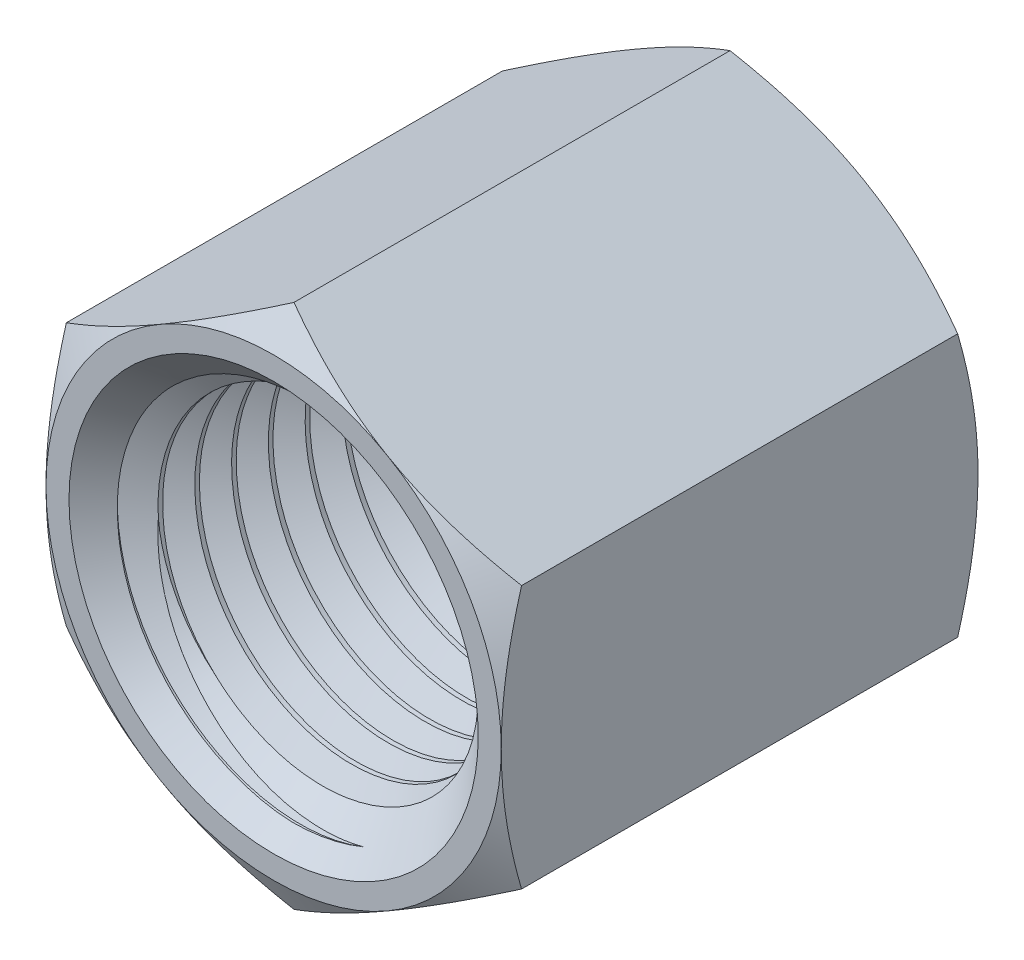
from build123d import *

# Parameters (mm, degrees)
BOSS_EXTRUDE1_DEPTH          = 9.144
BOSS_EXTRUDE1_DEPTH_BACK     = 9.144
SKETCH2_R                    = 5.588
SKETCH4_OUTSIDE_W            = 34.73
SKETCH4_OUTSIDE_H            = 37.432
SKETCH4_OUTSIDE_R            = 8.73125
CUT_EXTRUDE1_DEPTH           = 2.54
CUT_EXTRUDE1_DRAFT           = -60
MIRROR1_COPY_1_SKETCH_W      = 34.73
MIRROR1_COPY_1_SKETCH_H      = 37.432
MIRROR1_COPY_1_SKETCH_R      = 8.73125
MIRROR1_COPY_1_DEPTH         = 2.54
MIRROR1_COPY_1_DRAFT         = -60
SWEEP1_PITCH                 = 1.411111111
SKETCH7_R                    = 7.849305556
CUT_EXTRUDE2_DEPTH           = 2.54
CUT_EXTRUDE2_TAPER           = 45
CUT_EXTRUDE2_OTHER_WAY_DEPTH = 23.634751476


with BuildPart() as part:
    # Sketch2 → Boss-Extrude1 (new, two sides: drawn at the far end of the back side and taken through both)
    with BuildSketch(Plane.XY.offset(-BOSS_EXTRUDE1_DEPTH_BACK)):
        Polygon((0, 10.081979076), (-8.73125, 5.040989538), (-8.73125, -5.040989538), (0, -10.081979076), (8.73125, -5.040989538), (8.73125, 5.040989538), align=None)
        Circle(SKETCH2_R, mode=Mode.SUBTRACT)
    extrude(amount=BOSS_EXTRUDE1_DEPTH + BOSS_EXTRUDE1_DEPTH_BACK)

    # Sketch3 → Cut-Revolve1 (revolve, cut)
    with BuildSketch(Plane(origin=(0, 0, 0), x_dir=(0, 0, -1), z_dir=(1, 0, 0)), mode=Mode.PRIVATE) as cut_revolve1_sk:
        Polygon((-9.144, 7.14375), (2.286, 7.14375), (6.858, 5.588), (9.144, 5.588), (9.144, 0), (-9.144, 0), align=None)
    revolve(cut_revolve1_sk.sketch.rotate(Axis((0, 0, 9.144), (0, 0, -1)), 90), axis=Axis((0, 0, 9.144), (0, 0, -1)), mode=Mode.SUBTRACT)


with BuildPart() as cut_extrude1_tool:
    # Sketch4 outside → Cut-Extrude1 (with draft: the straight prism first)
    with BuildSketch(Plane.XY.offset(9.144)):
        Rectangle(SKETCH4_OUTSIDE_W, SKETCH4_OUTSIDE_H)
        Circle(SKETCH4_OUTSIDE_R, mode=Mode.SUBTRACT)
    extrude(amount=-CUT_EXTRUDE1_DEPTH)
    # Cut-Extrude1: the draft: its side faces are tilted about the plane it starts from
    cut_extrude1_sides = [cut_extrude1_tool.faces().sort_by_distance(p)[0] for p in [
        (0, -18.716, 7.874),
        (17.365, 0, 7.874),
        (0, 18.716, 7.874),
        (-17.365, 0, 7.874),
        (-8.73125, 0, 7.874),
    ]]
    draft(cut_extrude1_sides, Plane.XY.offset(9.144), CUT_EXTRUDE1_DRAFT)


with BuildPart() as part_1:
    add(part.part)

    # Cut-Extrude1: cut by cut_extrude1_tool
    add(cut_extrude1_tool.part, mode=Mode.SUBTRACT)


with BuildPart() as mirror1_copy_1_tool:
    # Mirror1 copy 1 sketch → Mirror1 copy 1 (with draft: the straight prism first)
    with BuildSketch(Plane(origin=(0, 0, -9.144), x_dir=(1, 0, 0), z_dir=(0, 0, -1))):
        Rectangle(MIRROR1_COPY_1_SKETCH_W, MIRROR1_COPY_1_SKETCH_H)
        Circle(MIRROR1_COPY_1_SKETCH_R, mode=Mode.SUBTRACT)
    extrude(amount=-MIRROR1_COPY_1_DEPTH)
    # Mirror1 copy 1: the draft: its side faces are tilted about the plane it starts from
    mirror1_copy_1_sides = [mirror1_copy_1_tool.faces().sort_by_distance(p)[0] for p in [
        (0, -18.716, -7.874),
        (17.365, 0, -7.874),
        (0, 18.716, -7.874),
        (-17.365, 0, -7.874),
        (-8.73125, 0, -7.874),
    ]]
    draft(mirror1_copy_1_sides, Plane(origin=(0, 0, -9.144), x_dir=(1, 0, 0), z_dir=(0, 0, -1)), MIRROR1_COPY_1_DRAFT)


with BuildPart() as part_2:
    add(part_1.part)

    # Mirror1 copy 1: cut by mirror1_copy_1_tool
    add(mirror1_copy_1_tool.part, mode=Mode.SUBTRACT)

    # Sweep1: the profile of Sketch6 profile screwed along a right-hand helix of 9.72 turns, 8 arcs to a turn; built about Z, then put on its axis
    sweep1_z = Axis((0, 0, 0), (0, 0, 1))
    sweep1_corners = [(7.14405, 0, 0.000173205), (6.150827818, 0, -0.573263889), (6.150827818, 0, -0.749652778), (7.14405, 0, -1.323089872)]
    with BuildLine(mode=Mode.PRIVATE) as sweep1_profile:
        Line(sweep1_corners[0], sweep1_corners[1])
        Line(sweep1_corners[1], sweep1_corners[2])
        Line(sweep1_corners[2], sweep1_corners[3])
        Line(sweep1_corners[3], sweep1_corners[0])
    sweep1_cap = Face(sweep1_profile.wire())
    sweep1_turn_angles = [0, 22.5, 45, 67.5, 90, 112.5, 135, 157.5, 180, 202.5, 225, 247.5, 270, 292.5, 315, 337.5, 360]
    sweep1_turn_weights = [1, 0.9238795325112867, 1, 0.9238795325112867, 1, 0.9238795325112867, 1, 0.9238795325112867, 1, 0.9238795325112867, 1, 0.9238795325112867, 1, 0.9238795325112867, 1, 0.9238795325112867, 1]
    sweep1_turn_rails = [Edge.make_bspline([Vector(p[0], p[1], 0).rotate(sweep1_z, sweep1_turn_angles[k]) / sweep1_turn_weights[k] + Vector(0, 0, p[2] + SWEEP1_PITCH * sweep1_turn_angles[k] / 360) for k in range(17)], [0, 0, 0, 1, 1, 2, 2, 3, 3, 4, 4, 5, 5, 6, 6, 7, 7, 8, 8, 8], 2, sweep1_turn_weights) for p in sweep1_corners]
    sweep1_turn_sides = [Face.make_surface_from_curves(sweep1_turn_rails[p[0]], sweep1_turn_rails[p[1]]) for p in [(0, 1), (1, 2), (2, 3), (3, 0)]]
    sweep1_last_angles = [3240, 3262.5, 3285, 3307.5, 3330, 3352.5, 3375, 3397.5, 3420, 3442.5, 3465, 3482.1, 3499.2]
    sweep1_last_weights = [1, 0.9238795325112867, 1, 0.9238795325112867, 1, 0.9238795325112867, 1, 0.9238795325112867, 1, 0.9238795325112867, 1, 0.9557930147984064, 1]
    sweep1_last_rails = [Edge.make_bspline([Vector(p[0], p[1], 0).rotate(sweep1_z, sweep1_last_angles[k]) / sweep1_last_weights[k] + Vector(0, 0, p[2] + SWEEP1_PITCH * sweep1_last_angles[k] / 360) for k in range(13)], [0, 0, 0, 1, 1, 2, 2, 3, 3, 4, 4, 5, 5, 6, 6, 6], 2, sweep1_last_weights) for p in sweep1_corners]
    sweep1_last_sides = [Face.make_surface_from_curves(sweep1_last_rails[p[0]], sweep1_last_rails[p[1]]) for p in [(0, 1), (1, 2), (2, 3), (3, 0)]]
    sweep1 = Plane(origin=(0, 0, 9.144), x_dir=(0, 1, 0), z_dir=(0, 0, -1)) * Solid(Shell([*[p.moved(Location((0, 0, SWEEP1_PITCH * i))) for i in range(9) for p in sweep1_turn_sides], *sweep1_last_sides, sweep1_cap, sweep1_cap.rotate(sweep1_z, 3499.2).moved(Location((0, 0, SWEEP1_PITCH * 3499.2 / 360)))]))
    add(sweep1)

    # Sketch7 → Cut-Extrude2 (cut)
    with BuildSketch(Plane.XY.offset(9.144)):
        Circle(SKETCH7_R)
    extrude(amount=-CUT_EXTRUDE2_DEPTH, taper=CUT_EXTRUDE2_TAPER, mode=Mode.SUBTRACT)

    # Sketch7 → Cut-Extrude2 other way (cut)
    with BuildSketch(Plane.XY.offset(9.144)):
        Circle(SKETCH7_R)
    extrude(amount=CUT_EXTRUDE2_OTHER_WAY_DEPTH, mode=Mode.SUBTRACT)


solid = part_2.part
